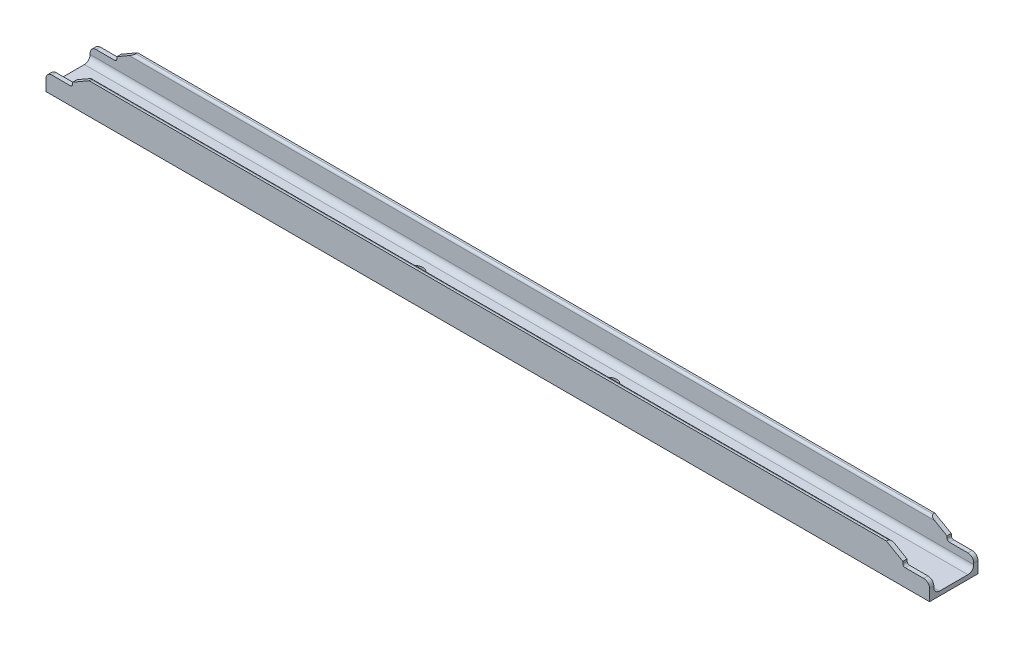
from build123d import *

# Parameters (mm, degrees)
EXTRUDE_1_DEPTH     = 456
SKETCH_2_R          = 8
CUT_EXTRUDE_1_DEPTH = 458.51804336
OTHER_START         = -25
OTHER_1_DEPTH       = 50
CUT_EXTRUDE_2_DEPTH = 461.472800608


# Read off the part's stored shape, not the designer's step: Полость1
with BuildPart() as part:
    # Эскиз1 → Бобышка-Вытянуть1 (new body)
    with BuildSketch(Plane(origin=(0, 0, 0), x_dir=(0, 0, -1), z_dir=(1, 0, 0))):
        with BuildLine():
            Line((25, -39.99), (-25, -39.99))
            Line((-25, -39.99), (-25, -7.99))
            Line((-25, -7.99), (-23.1, -7.99))
            ThreePointArc((-23.1, -7.99), (-21.332233047, -8.722233047), (-20.6, -10.49))
            Line((-20.6, -10.49), (-20.6, -29.59))
            ThreePointArc((-20.6, -29.59), (-18.842640687, -33.832640687), (-14.6, -35.59))
            Line((-14.6, -35.59), (14.6, -35.59))
            ThreePointArc((14.6, -35.59), (18.842640687, -33.832640687), (20.6, -29.59))
            Line((20.6, -29.59), (20.6, -10.49))
            ThreePointArc((20.6, -10.49), (21.332233047, -8.722233047), (23.1, -7.99))
            Line((23.1, -7.99), (25, -7.99))
            Line((25, -7.99), (25, -39.99))
        make_face()
    extrude(amount=-EXTRUDE_1_DEPTH)

    # Эскиз2 → Вырез-Вытянуть1 (cut, through all)
    with BuildSketch(Plane(origin=(0, -35.59, 0), x_dir=(1, 0, 0), z_dir=(0, 1, 0))):
        with Locations(Location((-100, 0, 0), (0, 0, 270))):
            Circle(SKETCH_2_R)
    extrude(amount=-CUT_EXTRUDE_1_DEPTH, mode=Mode.SUBTRACT)

    # Полость1 outline → Полость1 (cut)
    with BuildSketch(Plane.XY.offset(OTHER_START)):
        with BuildLine():
            Line((-428.4, -17.75), (-456, -17.75))
            Line((-456, -17.75), (-456, -28.15))
            ThreePointArc((-456, -28.15), (-454.242640687, -23.907359313), (-450, -22.15))
            Line((-450, -22.15), (-430.9, -22.15))
            ThreePointArc((-430.9, -22.15), (-429.132233047, -21.417766953), (-428.4, -19.65))
            Line((-428.4, -19.65), (-428.4, -17.75))
        make_face()
    extrude(amount=OTHER_1_DEPTH, mode=Mode.SUBTRACT)

    # Эскиз3 → Вырез-Вытянуть2 (cut, through all)
    with BuildSketch(Plane.XY.offset(25)):
        Polygon((-456, -17.75), (-428.4, -17.75), (-411.495184118, -7.99), (-456, -7.99), align=None)
    extrude(amount=-CUT_EXTRUDE_2_DEPTH, mode=Mode.SUBTRACT)

    # Зеркальное отражение1: part across plane


with BuildPart() as part_1:
    add(part.part)
    add(part.part.mirror(Plane(origin=(0, -10.49, 23.1), x_dir=(0, 0, 1), z_dir=(-1, 0, 0))))


solid = part_1.part
